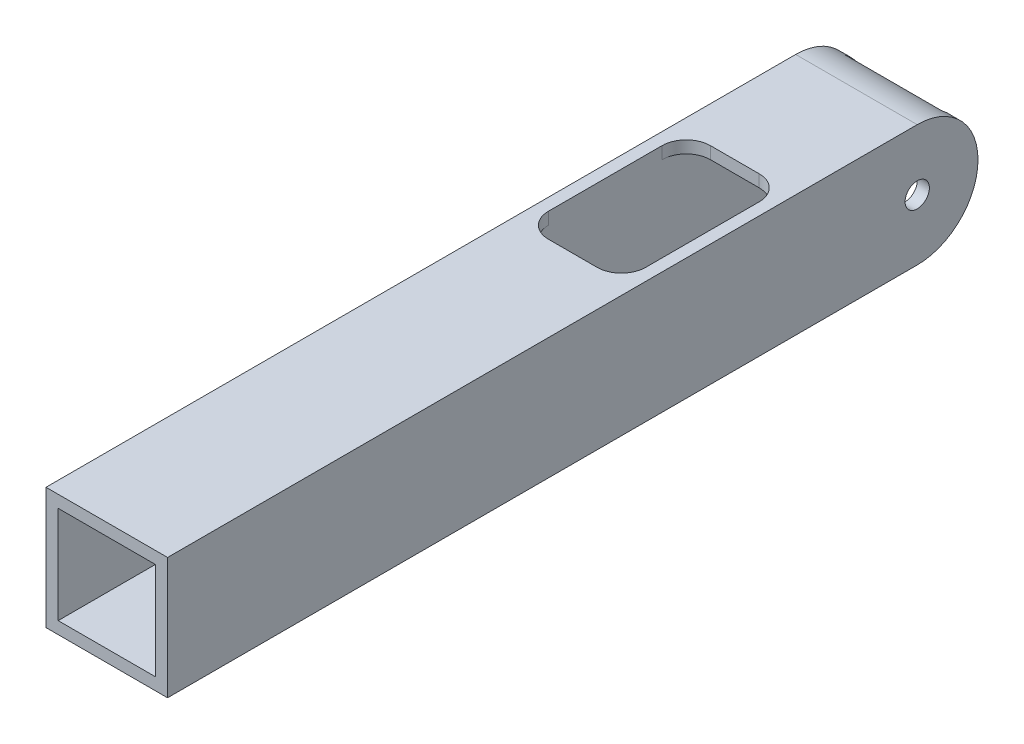
from build123d import *

# Parameters (mm, degrees)
ESQUISSE1_W             = 15
ESQUISSE1_H             = 15
EXTRUSION1_DEPTH        = 100
ESQUISSE2_W             = 12
ESQUISSE2_H             = 12
EXTRUSION2_DEPTH        = 101.560926806
CONG_1_R                = 7.5
ESQUISSE3_R             = 1.5
EXTRUSION3_DEPTH        = 102.396498953
ESQUISSE4_W             = 12
ESQUISSE4_H             = 20
ENL_V_MAT_EXTRU_1_DEPTH = 3
CONG_2_R                = 3


with BuildPart() as part:
    # Esquisse1 → Extrusion1 (new body)
    with BuildSketch(Plane.XY):
        Rectangle(ESQUISSE1_W, ESQUISSE1_H)
    extrude(amount=EXTRUSION1_DEPTH)

    # Esquisse2 → Extrusion2 (cut, through all)
    with BuildSketch(Plane.XY.offset(100)):
        Rectangle(ESQUISSE2_W, ESQUISSE2_H)
    extrude(amount=-EXTRUSION2_DEPTH, mode=Mode.SUBTRACT)

    # Congé1
    # the kernel refuses this fillet: 7.5 mm, written as the material it takes off along each edge
    with BuildSketch(Plane(origin=(-26.25, -7.5, 0), x_dir=(0, 0, 1), z_dir=(1, 0, 0))) as cong_1_piece_1:
        with BuildLine():
            CenterArc((CONG_1_R, -CONG_1_R), CONG_1_R, 90, 90)
            Line((0, -CONG_1_R), (0, 0))
            Line((0, 0), (CONG_1_R, 0))
        make_face()
    extrude(amount=52.5, mode=Mode.SUBTRACT)
    with BuildSketch(Plane(origin=(26.25, 7.5, 0), x_dir=(0, -1, 0), z_dir=(-1, 0, 0))) as cong_1_piece_2:
        with BuildLine():
            CenterArc((CONG_1_R, CONG_1_R), CONG_1_R, 180, 90)
            Line((0, CONG_1_R), (0, 0))
            Line((0, 0), (CONG_1_R, 0))
        make_face()
    extrude(amount=52.5, mode=Mode.SUBTRACT)

    # Esquisse3 → Extrusion3 (cut, through all)
    with BuildSketch(Plane(origin=(7.5, 0, 0), x_dir=(0, 0, -1), z_dir=(1, 0, 0))):
        with Locations((-7.5, 0)):
            Circle(ESQUISSE3_R)
    extrude(amount=-EXTRUSION3_DEPTH, mode=Mode.SUBTRACT)

    # Esquisse4 → Enlèv. mat.-Extru.1 (cut)
    with BuildSketch(Plane(origin=(0, 7.5, 0), x_dir=(-1, 0, 0), z_dir=(0, 1, 0))):
        with Locations((0, 32.5)):
            Rectangle(ESQUISSE4_W, ESQUISSE4_H)
    extrude(amount=-ENL_V_MAT_EXTRU_1_DEPTH, mode=Mode.SUBTRACT)

    # Congé2
    cong_2_edges = [part.edges().sort_by_distance(p)[0] for p in [
        (-6, 6.75, 42.5),
        (-6, 6.75, 22.5),
        (6, 6.75, 22.5),
        (6, 6.75, 42.5),
    ]]
    fillet(cong_2_edges, radius=CONG_2_R)


solid = part.part
